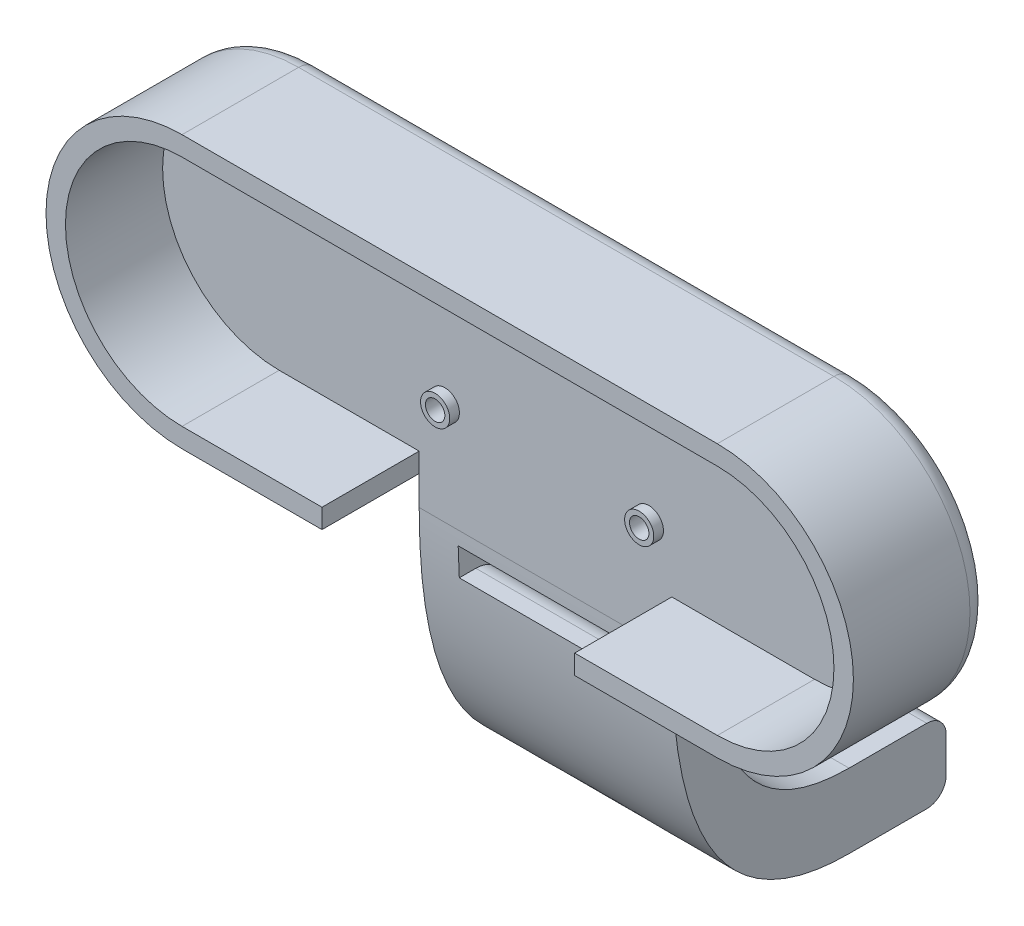
from build123d import *

# Parameters (mm, degrees)
SKETCH1_R                = 1
BOSS_EXTRUDE2_DEPTH      = 4
BOSS_EXTRUDE3_DEPTH      = 10
SKETCH3_W                = 26
SKETCH3_H                = 10
CUT_EXTRUDE1_DEPTH       = 10
BOSS_EXTRUDE4_DEPTH      = 26
SKETCH8_W                = 23
SKETCH8_H                = 4
CUT_EXTRUDE5_DEPTH       = 9
SKETCH10_R               = 3
CUT_EXTRUDE7_DEPTH       = 0.7
SKETCH11_R               = 2
CUT_EXTRUDE8_DEPTH       = 10.7
BOSS_EXTRUDE5_START      = -26
BOSS_EXTRUDE5_DEPTH      = 26
SKETCH14_W               = 18
SKETCH14_H               = 1
CUT_EXTRUDE10_DEPTH      = 5
CUT_EXTRUDE11_DEPTH      = 1
CUT_EXTRUDE11_DEPTH_BACK = 5.5
SKETCH15_W               = 18
SKETCH15_H               = 2.914160071
SKETCH16_R               = 1.5
SKETCH16_R_2             = 1
BOSS_EXTRUDE6_DEPTH      = 1
FILLET3_R                = 2
FILLET4_R                = 3


# Read off the part's stored shape, not the designer's step: Boss-Extrude5
with BuildPart() as part:
    # Sketch1 → Boss-Extrude2 (new body)
    with BuildSketch(Plane.XY):
        with BuildLine():
            Line((-18.57209146, 27.379059863), (36.519389128, 27.379059863))
            ThreePointArc((36.519389128, 27.379059863), (50.519389128, 13.379059863), (36.519389128, -0.620940137))
            Line((36.519389128, -0.620940137), (21.833027405, -0.620940137))
            Line((21.833027405, -0.620940137), (21.833027405, -3.648981121))
            Line((21.833027405, -3.648981121), (-4.166972595, -3.648981121))
            Line((-4.166972595, -3.648981121), (-4.166972595, -0.620940137))
            Line((-4.166972595, -0.620940137), (-18.57209146, -0.620940137))
            ThreePointArc((-18.57209146, -0.620940137), (-32.57209146, 13.379059863), (-18.57209146, 27.379059863))
        make_face()
        with Locations((-1.526351166, 20.851018883)):
            Circle(SKETCH1_R, mode=Mode.SUBTRACT)
        with Locations((19.473648834, 20.851018883)):
            Circle(SKETCH1_R, mode=Mode.SUBTRACT)
        with Locations((-1.526351166, 6.851018883)):
            Circle(SKETCH1_R, mode=Mode.SUBTRACT)
        with Locations((19.473648834, 6.851018883)):
            Circle(SKETCH1_R, mode=Mode.SUBTRACT)
    extrude(amount=BOSS_EXTRUDE2_DEPTH)

    # Sketch2 → Boss-Extrude3 (add)
    with BuildSketch(Plane.XY.offset(4)):
        with BuildLine():
            Line((-4.166972595, -0.620940137), (-4.166972595, -0.624002345))
            Line((-4.166972595, -0.624002345), (21.833027405, -0.624002345))
            Line((21.833027405, -0.624002345), (21.833027405, -0.620940137))
            Line((21.833027405, -0.620940137), (36.519389128, -0.620940137))
            ThreePointArc((36.519389128, -0.620940137), (50.519389128, 13.379059863), (36.519389128, 27.379059863))
            Line((36.519389128, 27.379059863), (-18.57209146, 27.379059863))
            ThreePointArc((-18.57209146, 27.379059863), (-32.57209146, 13.379059863), (-18.57209146, -0.620940137))
            Line((-18.57209146, -0.620940137), (-4.166972595, -0.620940137))
        make_face()
        with BuildLine():
            ThreePointArc((-18.57209146, 1.379059863), (-30.57209146, 13.379059863), (-18.57209146, 25.379059863))
            Line((-18.57209146, 25.379059863), (36.519389128, 25.379059863))
            ThreePointArc((36.519389128, 25.379059863), (48.519389128, 13.379059863), (36.519389128, 1.379059863))
            Line((36.519389128, 1.379059863), (-18.57209146, 1.379059863))
        make_face(mode=Mode.SUBTRACT)
    extrude(amount=BOSS_EXTRUDE3_DEPTH)

    # Sketch3 → Cut-Extrude1 (cut)
    with BuildSketch(Plane.XZ.offset(0.624002345)):
        with Locations((8.833027405, 9)):
            Rectangle(SKETCH3_W, SKETCH3_H)
    extrude(amount=-CUT_EXTRUDE1_DEPTH, mode=Mode.SUBTRACT)

    # Sketch4 → Boss-Extrude4 (add)
    with BuildSketch(Plane(origin=(21.833027405, 0, 0), x_dir=(0, 0, -1), z_dir=(1, 0, 0))):
        with BuildLine():
            Line((-4, -3.648981121), (7.0957e-05, -3.648981121))
            add(Edge.make_bspline(
                [(7.0957e-05, -3.648981121), (7.0957e-05, -22.995880537), (14.23768392, -22.995880537)],
                knots=[0, 0, 0, 1, 1, 1], degree=2))
            Line((14.23768392, -22.995880537), (22.23768392, -22.995880537))
            ThreePointArc((22.23768392, -22.995880537), (23.651897483, -23.581666974), (24.23768392, -24.995880537))
            Line((24.23768392, -24.995880537), (24.23768392, -28.620008298))
            ThreePointArc((24.23768392, -28.620008298), (23.651897483, -30.034221861), (22.23768392, -30.620008298))
            Line((22.23768392, -30.620008298), (14.23768392, -30.620008298))
            add(Edge.make_bspline(
                [(-4, -3.648981121), (-3.999929043, -30.620008298), (14.23768392, -30.620008298)],
                knots=[0, 0, 0, 1, 1, 1], degree=2))
        make_face()
    extrude(amount=-BOSS_EXTRUDE4_DEPTH)

    # Sketch8 → Cut-Extrude5 (cut)
    with BuildSketch(Plane(origin=(0, 0, -24.237684184), x_dir=(-1, 0, 0), z_dir=(0, 0, -1))):
        with Locations((-8.833027405, -28.620008644)):
            Rectangle(SKETCH8_W, SKETCH8_H)
    extrude(amount=-CUT_EXTRUDE5_DEPTH, mode=Mode.SUBTRACT)

    # Sketch10 → Cut-Extrude7 (cut)
    with BuildSketch(Plane(origin=(0, -22.995880711, 0), x_dir=(1, 0, 0), z_dir=(0, 1, 0))):
        with Locations(Location((8.833027405, 19.237684184, 0), (0, 0, 270))):
            Circle(SKETCH10_R)
    extrude(amount=-CUT_EXTRUDE7_DEPTH, mode=Mode.SUBTRACT)

    # Sketch11 → Cut-Extrude8 (cut)
    with BuildSketch(Plane(origin=(0, -23.695880711, 0), x_dir=(1, 0, 0), z_dir=(0, 1, 0))):
        with Locations(Location((8.833027405, 19.23768392, 0), (0, 0, 270))):
            Circle(SKETCH11_R)
    extrude(amount=-CUT_EXTRUDE8_DEPTH, mode=Mode.SUBTRACT)

    # Boss-Extrude5 outline → Boss-Extrude5 (add)
    with BuildSketch(Plane(origin=(21.833027405, 0, 0), x_dir=(0, 0, -1), z_dir=(1, 0, 0)).offset(BOSS_EXTRUDE5_START)):
        with BuildLine():
            ThreePointArc((2.392558217, -5.066956781), (1.80677178, -3.652743218), (0.392558217, -3.066956781))
            Line((0.392558217, -3.066956781), (-1, -3.066956781))
            Line((-1, -3.066956781), (-1, -3.648981121))
            Line((-1, -3.648981121), (7.0828e-05, -3.648981121))
            add(Edge.make_bspline(
                [(0.828692106, -11.857711885), (7.0827e-05, -8.316335967), (7.0828e-05, -3.648981121)],
                knots=[0.758754376, 0.758754376, 0.758754376, 1, 1, 1], degree=2))
            Line((0.828692106, -11.857711885), (2.392558217, -11.857711885))
            Line((2.392558217, -11.857711885), (2.392558217, -5.066956781))
        make_face()
    extrude(amount=BOSS_EXTRUDE5_DEPTH)

    # Sketch14 → Cut-Extrude10 (cut)
    with BuildSketch(Plane.XZ.offset(11.857711885)):
        with Locations((8.833027405, -1.328692104)):
            Rectangle(SKETCH14_W, SKETCH14_H)
    extrude(amount=-CUT_EXTRUDE10_DEPTH, mode=Mode.SUBTRACT)

    # Sketch15 → Cut-Extrude11 (cut, two sides: drawn at the far end of the back side and taken through both)
    with BuildSketch(Plane(origin=(0, 0, -0.828692104), x_dir=(-1, 0, 0), z_dir=(0, 0, -1)).offset(-CUT_EXTRUDE11_DEPTH_BACK)):
        with Locations((-8.833027405, -6.524036817)):
            Rectangle(SKETCH15_W, SKETCH15_H)
    extrude(amount=CUT_EXTRUDE11_DEPTH + CUT_EXTRUDE11_DEPTH_BACK, mode=Mode.SUBTRACT)

    # Sketch16 → Boss-Extrude6 (add)
    # profile 1 of 4: a face of its own
    with BuildSketch(Plane.XY.offset(4)):
        with Locations((-1.526351166, 20.851018883)):
            Circle(SKETCH16_R)
        with Locations((-1.526351166, 20.851018883)):
            Circle(SKETCH16_R_2, mode=Mode.SUBTRACT)
    # profile 2 of 4: a face of its own
    with BuildSketch(Plane.XY.offset(4)):
        with Locations((-1.526351166, 6.851018883)):
            Circle(SKETCH16_R)
        with Locations((-1.526351166, 6.851018883)):
            Circle(SKETCH16_R_2, mode=Mode.SUBTRACT)
    # profile 3 of 4: a face of its own
    with BuildSketch(Plane.XY.offset(4)):
        with Locations((19.473648834, 20.851018883)):
            Circle(SKETCH16_R)
        with Locations((19.473648834, 20.851018883)):
            Circle(SKETCH16_R_2, mode=Mode.SUBTRACT)
    # profile 4 of 4: a face of its own
    with BuildSketch(Plane.XY.offset(4)):
        with Locations((19.473648834, 6.851018883)):
            Circle(SKETCH16_R)
        with Locations((19.473648834, 6.851018883)):
            Circle(SKETCH16_R_2, mode=Mode.SUBTRACT)
    extrude(amount=BOSS_EXTRUDE6_DEPTH)

    # Fillet3
    fillet3_edges = [part.edges().sort_by_distance(p)[0] for p in [
        (50.519389128, 13.379059863, 0),
        (29.176208267, -0.620940137, 0),
        (-11.369532027, -0.620940137, 0),
        (-32.57209146, 13.379059863, 0),
        (8.973648834, 27.379059863, 0),
    ]]
    fillet(fillet3_edges, radius=FILLET3_R)

    # Fillet4
    fillet4_edges = [part.edges().sort_by_distance(p)[0] for p in [
        (8.833027405, -7.981116852, -0.828692104),
    ]]
    fillet(fillet4_edges, radius=FILLET4_R)


solid = part.part
